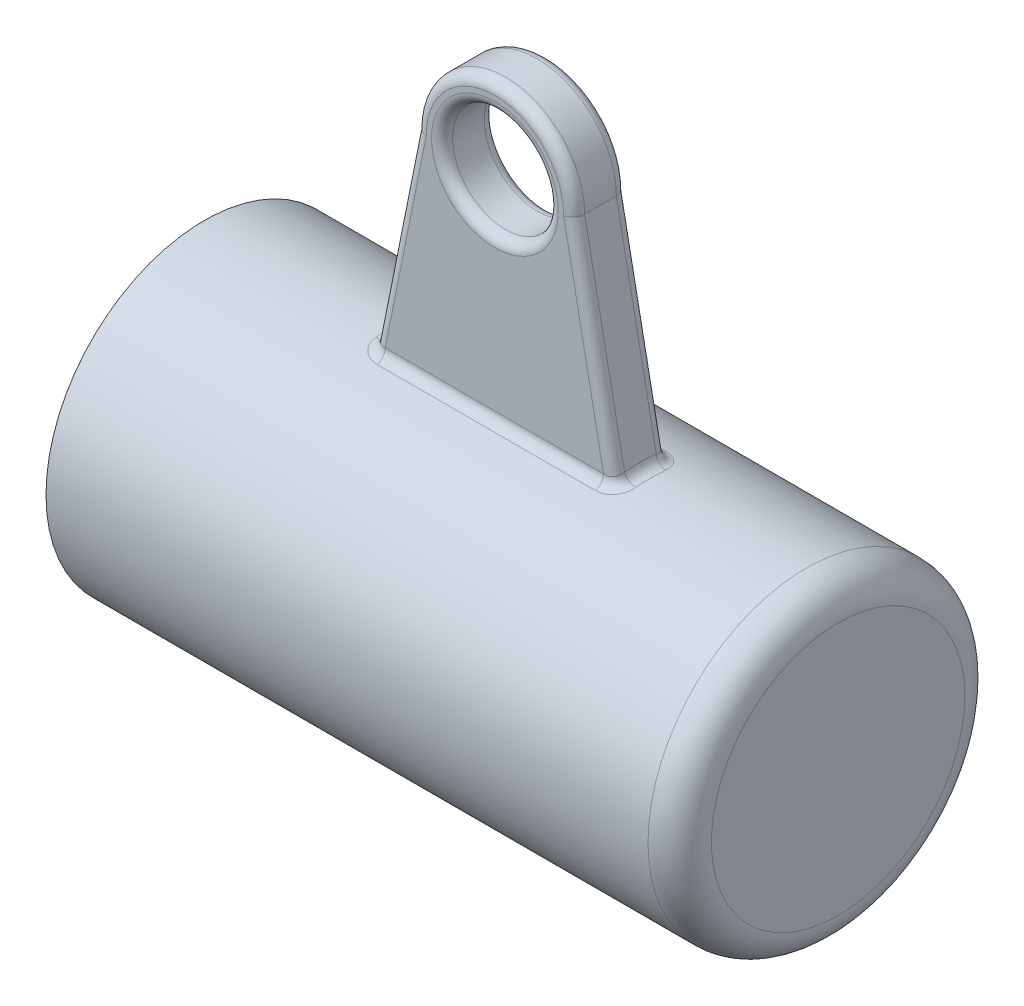
from build123d import *

# Parameters (mm, degrees)
SKETCH1_R           = 15.000000000000002
BOSS_EXTRUDE1_DEPTH = 30.000000000000004
SKETCH2_R           = 12.5
CUT_EXTRUDE1_DEPTH  = 10
SKETCH3_R           = 6
BOSS_EXTRUDE2_DEPTH = 5
DOME1_FACE_RADIUS   = 6
DOME1_HEIGHT        = 10
FILLET1_R           = 3
FILLET2_R           = 3
BOSS_EXTRUDE3_DEPTH = 2.5
SKETCH6_R           = 4.999999999999999
CUT_EXTRUDE2_DEPTH  = 25
FILLET3_R           = 1


with BuildPart() as part:
    # Sketch1 → Boss-Extrude1 (new, symmetric)
    with BuildSketch(Plane(origin=(0, 0, 0), x_dir=(0, 0, -1), z_dir=(1, 0, 0))):
        with Locations(Location((0, 0, 0), (0, 0, 180))):
            Circle(SKETCH1_R)
    extrude(amount=BOSS_EXTRUDE1_DEPTH, both=True)

    # Sketch2 → Cut-Extrude1 (cut)
    with BuildSketch(Plane.ZY.offset(30.000000000000004)):
        Circle(SKETCH2_R)
    extrude(amount=-CUT_EXTRUDE1_DEPTH, mode=Mode.SUBTRACT)

    # Sketch3 → Boss-Extrude2 (add, symmetric)
    with BuildSketch(Plane.ZY.offset(20.000000000000004)):
        Circle(SKETCH3_R)
    extrude(amount=BOSS_EXTRUDE2_DEPTH, both=True)

    # Dome1: a dome of height H over a round flat face of radius A is a cap of a sphere of radius (A * A + H * H) / (2 * H)
    dome1_r = (DOME1_FACE_RADIUS * DOME1_FACE_RADIUS + DOME1_HEIGHT * DOME1_HEIGHT) / (2 * DOME1_HEIGHT)
    dome1_base = Plane((-25, 0, 0), z_dir=(-1, 0, 0))
    with Locations(dome1_base.offset(DOME1_HEIGHT - dome1_r)):
        dome1_ball = Sphere(dome1_r, mode=Mode.PRIVATE)
    add(split(dome1_ball, bisect_by=dome1_base, keep=Keep.TOP, mode=Mode.PRIVATE))

    # Fillet1
    # the kernel refuses this fillet: 3 mm, written as the material it takes off along each edge
    with BuildSketch(Plane(origin=(-30.000000000000004, 0, 0), x_dir=(0, 0, 1), z_dir=(0, -1, 0))) as fillet1_piece_1:
        with BuildLine():
            CenterArc((15.5, -2.958039891550115), FILLET1_R, 99.59406822685946, 80.40593177314054)
            Line((12.5, -2.958039891550115), (12.44, -2.958039891550115))
            Line((12.44, -2.958039891550115), (12.44, 0))
            Line((12.44, 0), (12.5, 0.05999999999999872))
            ThreePointArc((12.5, 0.05999999999999872), (13.750000000000025, 0.05999999999999872), (14.990000000000052, 0.05916079783069961))
            Line((14.990000000000052, 0.05916079783069961), (15.000000000000052, -2.9843e-13))
        make_face()
    revolve(axis=Axis((-30.000000000000004, 0, 0), (-1, 0, 0)), mode=Mode.SUBTRACT)

    # Fillet2
    fillet2_edges = [part.edges().sort_by_distance(p)[0] for p in [
        (30.000000000000004, -3.67e-15, -15.000000000000002),
    ]]
    fillet(fillet2_edges, radius=FILLET2_R)

    # Sketch5 → Boss-Extrude3 (add, symmetric)
    with BuildSketch(Plane.XY):
        with BuildLine():
            Line((-7.5, 35), (-12, 12.614585565744962))
            Line((-12, 12.614585565744962), (12, 12.059453131031052))
            Line((12, 12.059453131031052), (7.5, 35))
            ThreePointArc((7.5, 35), (4.6e-16, 42.5), (-7.5, 35))
        make_face()
    extrude(amount=BOSS_EXTRUDE3_DEPTH, both=True)

    # Sketch6 → Cut-Extrude2 (cut)
    with BuildSketch(Plane(origin=(0, 0, -2.5), x_dir=(-1, 0, 0), z_dir=(0, 0, -1))):
        with Locations((0, 35)):
            Circle(SKETCH6_R)
    extrude(amount=-CUT_EXTRUDE2_DEPTH, mode=Mode.SUBTRACT)

    # Fillet3
    fillet3_edges = [part.edges().sort_by_distance(p)[0] for p in [
        (-0.04915551406198659, 14.790199457749042, -2.5),
        (11.423184591634147, 15.000000000000002, -1.84e-15),
        (-11.52047504031368, 15.000000000000002, 3.67e-15),
        (-0.04915551406198659, 14.790199457749042, 2.5),
        (9.48216945218396, 24.89509972887452, 2.5),
        (2.12e-15, 42.5, 2.5),
        (-9.531324966245947, 24.89509972887452, 2.5),
        (2.12e-15, 42.5, -2.5),
        (-9.531324966245947, 24.89509972887452, -2.5),
        (9.48216945218396, 24.89509972887452, -2.5),
        (4.999999999999999, 35, 2.5),
        (4.999999999999999, 35, -2.5),
    ]]
    fillet(fillet3_edges, radius=FILLET3_R)


solid = part.part
